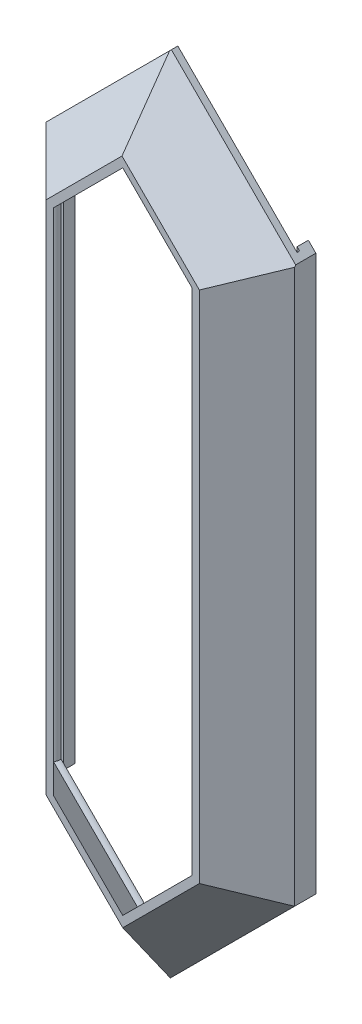
from build123d import *

# Parameters (mm, degrees)
EXTRUDE_2_DEPTH          = 8
CUT_EXTRUDE_1_DEPTH      = 8
CUT_EXTRUDE_1_DRAFT      = -45
SKETCH_3_OUTSIDE_W       = 84.568
SKETCH_3_OUTSIDE_H       = 173.168
CUT_EXTRUDE_5_DEPTH      = 8
CUT_EXTRUDE_5_DRAFT      = -45
EXTRUDE_1_DEPTH          = 3
FILLET_1_R               = 1
FILLET_2_R               = 1
CUT_EXTRUDE_6_DEPTH      = 37.9
CUT_EXTRUDE_6_DEPTH_BACK = 0.4
SKETCH_5_W               = 0.4
SKETCH_5_H               = 87.60588745
SKETCH_7_W               = 38.3
SKETCH_7_H               = 22.901916238
CUT_EXTRUDE_8_DEPTH      = 0.4
SKETCH_8_W               = 38.3
SKETCH_8_H               = 25.571304525
CUT_EXTRUDE_9_DEPTH      = 0.4
SKETCH_9_W               = 37.268690424
SKETCH_9_H               = 136.16118074
CUT_EXTRUDE_10_DEPTH     = 1.8


with BuildPart() as part:
    # Skizze1 → Бобышка-Вытянуть2 (new body)
    with BuildSketch(Plane.XY):
        Polygon((-19.834345212, 44.1), (0, 63.934345212), (19.834345212, 44.1), (19.834345212, -44.5), (0, -64.334345212), (-19.834345212, -44.5), align=None)
    extrude(amount=EXTRUDE_2_DEPTH)


with BuildPart() as cut_extrude_1_tool:
    # Эскиз1 → Вырез-Вытянуть1 (with draft: the straight prism first)
    with BuildSketch(Plane(origin=(0, 0, 0), x_dir=(-1, 0, 0), z_dir=(0, 0, -1))):
        Polygon((0, 62.802974362), (-19.034345212, 43.76862915), (-19.034345212, -44.16862915), (0, -63.202974362), (19.034345212, -44.16862915), (19.034345212, 43.76862915), align=None)
    extrude(amount=-CUT_EXTRUDE_1_DEPTH)
    # Вырез-Вытянуть1: the draft: its side faces are tilted about the plane it starts from
    cut_extrude_1_sides = [cut_extrude_1_tool.faces().sort_by_distance(p)[0] for p in [
        (9.517172606, 53.285801756, 4),
        (19.034345212, -0.2, 4),
        (9.517172606, -53.685801756, 4),
        (-9.517172606, -53.685801756, 4),
        (-19.034345212, -0.2, 4),
        (-9.517172606, 53.285801756, 4),
    ]]
    draft(cut_extrude_1_sides, Plane(origin=(0, 0, 0), x_dir=(-1, 0, 0), z_dir=(0, 0, -1)), CUT_EXTRUDE_1_DRAFT)


with BuildPart() as part_1:
    add(part.part)

    # Вырез-Вытянуть1: cut by cut_extrude_1_tool
    add(cut_extrude_1_tool.part, mode=Mode.SUBTRACT)


with BuildPart() as cut_extrude_5_tool:
    # Эскиз3 outside → Вырез-Вытянуть5 (with draft: the straight prism first)
    with BuildSketch(Plane.XY.offset(8)):
        with Locations((0, -0.2)):
            Rectangle(SKETCH_3_OUTSIDE_W, SKETCH_3_OUTSIDE_H)
        Polygon((-12.234345212, 40.951976926), (-12.234345212, -41.351976926), (0, -53.586322138), (12.234345212, -41.351976926), (12.234345212, 40.711808204), (-0.120084361, 53.066237777), align=None, mode=Mode.SUBTRACT)
    extrude(amount=-CUT_EXTRUDE_5_DEPTH)
    # Вырез-Вытянуть5: the draft: its side faces are tilted about the plane it starts from
    cut_extrude_5_sides = [cut_extrude_5_tool.faces().sort_by_distance(p)[0] for p in [
        (0, -86.784, 4),
        (42.284, -0.2, 4),
        (0, 86.384, 4),
        (-42.284, -0.2, 4),
        (-6.177214787, 47.009107352, 4),
        (6.057130426, 46.889022991, 4),
        (12.234345212, -0.320084361, 4),
        (6.117172606, -47.469149532, 4),
        (-6.117172606, -47.469149532, 4),
        (-12.234345212, -0.2, 4),
    ]]
    draft(cut_extrude_5_sides, Plane.XY.offset(8), CUT_EXTRUDE_5_DRAFT)


with BuildPart() as part_2:
    add(part_1.part)

    # Вырез-Вытянуть5: cut by cut_extrude_5_tool
    add(cut_extrude_5_tool.part, mode=Mode.SUBTRACT)

    # Эскиз4 → Вытянуть-Тонкостенный1 (add)
    with BuildSketch(Plane(origin=(0, 0, 0), x_dir=(-1, 0, 0), z_dir=(0, 0, -1))):
        Polygon((19.834345212, 44.1), (19.834345212, -44.5), (0, -64.334345212), (-19.834345212, -44.5), (-19.834345212, 44.1), (0, 63.934345212), align=None)
        Polygon((18.634345212, 43.602943725), (18.634345212, -44.002943725), (0, -62.637288937), (-18.634345212, -44.002943725), (-18.634345212, 43.602943725), (0, 62.237288937), align=None, mode=Mode.SUBTRACT)
    extrude(amount=EXTRUDE_1_DEPTH)

    # Скругление1
    # the kernel refuses this fillet: 1 mm, written as the material it takes off along each edge
    with BuildSketch(Plane(origin=(-18.634345212, 45.602943725, 0), x_dir=(-1, 0, 0), z_dir=(0, -1, 0))) as fillet_1_piece_1_section:
        with BuildLine():
            CenterArc((1, 0.8), FILLET_1_R, 180, 53.130102354)
            Line((0, 0.8), (-0.02, 0.8))
            Line((-0.02, 0.8), (-0.02, 0))
            Line((-0.02, 0), (0, -0.02))
            ThreePointArc((0, -0.02), (0.2, -0.02), (0.388, -0.016))
            Line((0.388, -0.016), (0.4, 0))
        make_face()
    fillet_1_piece_1 = extrude(amount=91.60588745, mode=Mode.PRIVATE)
    fillet_1_piece_1 = split(fillet_1_piece_1, bisect_by=Plane(origin=(-18.834345212, 45.602943725, 0.2), z_dir=(0.7071067811865462, 0, -0.7071067811865488)), keep=Keep.TOP, mode=Mode.PRIVATE)
    fillet_1_piece_1 = split(fillet_1_piece_1, bisect_by=Plane(origin=(-63.437288937, 0.8, 0), z_dir=(0.7071067811865476, 0.7071067811865476, 0)), keep=Keep.TOP, mode=Mode.PRIVATE)
    fillet_1_piece_1 = split(fillet_1_piece_1, bisect_by=Plane(origin=(-17.634345212, 44.602943725, 0), z_dir=(0.7071067811865469, -0.7071067811865481, 0)), keep=Keep.TOP, mode=Mode.PRIVATE)
    add(fillet_1_piece_1, mode=Mode.SUBTRACT)
    with BuildSketch(Plane(origin=(0, 62.237288937, 0), x_dir=(-0.7071067811865469, 0.7071067811865482, 0), z_dir=(-0.7071067811865481, -0.7071067811865469, 0))) as fillet_1_piece_2_section:
        with BuildLine():
            CenterArc((1, 0.8), FILLET_1_R, 180, 53.130102354)
            Line((0, 0.8), (-0.02, 0.8))
            Line((-0.02, 0.8), (-0.02, 0))
            Line((-0.02, 0), (0, -0.02))
            ThreePointArc((0, -0.02), (0.2, -0.02), (0.388, -0.016))
            Line((0.388, -0.016), (0.4, 0))
        make_face()
    fillet_1_piece_2 = extrude(amount=28.352943725, mode=Mode.PRIVATE)
    fillet_1_piece_2 = split(fillet_1_piece_2, bisect_by=Plane(origin=(-0.141421356, 62.378710294, 0.2), z_dir=(0.499999999999999, -0.4999999999999993, -0.7071067811865488)), keep=Keep.TOP, mode=Mode.PRIVATE)
    fillet_1_piece_2 = split(fillet_1_piece_2, bisect_by=Plane(origin=(-18.634345212, 62.237288937, 0), z_dir=(1, 0, 0)), keep=Keep.TOP, mode=Mode.PRIVATE)
    add(fillet_1_piece_2, mode=Mode.SUBTRACT)
    with BuildSketch(Plane(origin=(0, 62.237288937, 0), x_dir=(-0.7071067811865469, 0.7071067811865482, 0), z_dir=(-0.7071067811865481, -0.7071067811865469, 0))) as fillet_1_piece_3a_section:
        with BuildLine():
            CenterArc((1, 0.8), FILLET_1_R, 180, 53.130102354)
            Line((0, 0.8), (-0.02, 0.8))
            Line((-0.02, 0.8), (-0.02, 0))
            Line((-0.02, 0), (0, -0.02))
            ThreePointArc((0, -0.02), (0.2, -0.02), (0.388, -0.016))
            Line((0.388, -0.016), (0.4, 0))
        make_face()
    fillet_1_piece_3a = extrude(amount=28.352943725, mode=Mode.PRIVATE)
    fillet_1_piece_3a = split(fillet_1_piece_3a, bisect_by=Plane(origin=(-9.517172606, 62.237288937, 9.517172606), z_dir=(0.7071067811865462, 0, -0.7071067811865488)), keep=Keep.TOP, mode=Mode.PRIVATE)
    fillet_1_piece_3a = split(fillet_1_piece_3a, bisect_by=Plane(origin=(-0.141421356, 62.378710294, 0.2), z_dir=(0.499999999999999, -0.4999999999999993, -0.7071067811865488)), keep=Keep.TOP, mode=Mode.PRIVATE)
    fillet_1_piece_3a = split(fillet_1_piece_3a, bisect_by=Plane(origin=(-18.634345212, 62.237288937, 0), z_dir=(-1, 0, 0)), keep=Keep.TOP, mode=Mode.PRIVATE)
    with BuildSketch(Plane(origin=(-18.634345212, 45.602943725, 0), x_dir=(-1, 0, 0), z_dir=(0, -1, 0))) as fillet_1_piece_3b_section:
        with BuildLine():
            CenterArc((1, 0.8), FILLET_1_R, 180, 53.130102354)
            Line((0, 0.8), (-0.02, 0.8))
            Line((-0.02, 0.8), (-0.02, 0))
            Line((-0.02, 0), (0, -0.02))
            ThreePointArc((0, -0.02), (0.2, -0.02), (0.388, -0.016))
            Line((0.388, -0.016), (0.4, 0))
        make_face()
    fillet_1_piece_3b = extrude(amount=91.60588745, mode=Mode.PRIVATE)
    fillet_1_piece_3b = split(fillet_1_piece_3b, bisect_by=Plane(origin=(-18.834345212, 45.602943725, 0.2), z_dir=(0.7071067811865462, 0, -0.7071067811865488)), keep=Keep.TOP, mode=Mode.PRIVATE)
    fillet_1_piece_3b = split(fillet_1_piece_3b, bisect_by=Plane(origin=(-18.275766569, 45.244365081, -0.507106781), z_dir=(0.499999999999999, -0.4999999999999993, -0.7071067811865488)), keep=Keep.TOP, mode=Mode.PRIVATE)
    fillet_1_piece_3b = split(fillet_1_piece_3b, bisect_by=Plane(origin=(-17.634345212, 44.602943725, 0), z_dir=(-0.7071067811865469, 0.7071067811865481, 0)), keep=Keep.TOP, mode=Mode.PRIVATE)
    fillet_1_piece_3 = fillet_1_piece_3a & fillet_1_piece_3b
    add(fillet_1_piece_3, mode=Mode.SUBTRACT)

    # Скругление2
    # the kernel refuses this fillet: 1 mm, written as the material it takes off along each edge
    with BuildSketch(Plane(origin=(-20.802112165, -41.835176772, 0), x_dir=(-0.7071067811865467, -0.7071067811865485, -2.6367796834847523e-15), z_dir=(0.7071067811865485, -0.7071067811865466, 0))) as fillet_2_piece_1_section:
        with BuildLine():
            CenterArc((FILLET_2_R, FILLET_2_R), FILLET_2_R, 180, 90)
            Line((0, FILLET_2_R), (0, 0))
            Line((0, 0), (FILLET_2_R, 0))
        make_face()
    fillet_2_piece_1 = extrude(amount=2.899999894, mode=Mode.PRIVATE)
    fillet_2_piece_1 = fillet_2_piece_1 - Plane(origin=(-19.634345212, -41.835176772, -0.8), x_dir=(-1, 0, 0), z_dir=(0, 1, 0)) * Cylinder(1, 10, mode=Mode.PRIVATE)
    add(fillet_2_piece_1, mode=Mode.SUBTRACT)
    with BuildSketch(Plane(origin=(-18.751502574, -43.885786363, 0), x_dir=(-0.7071067811865466, -0.7071067811865485, -1.909421767788959e-14), z_dir=(0.7071067811865485, -0.7071067811865466, 0))) as fillet_2_piece_2_section:
        with BuildLine():
            CenterArc((1, 0.8), FILLET_2_R, 180, 53.130102354)
            Line((0, 0.8), (0, 0))
            Line((0, 0), (0.4, 0))
        make_face()
    fillet_2_piece_2 = extrude(amount=26.518629256, mode=Mode.PRIVATE)
    fillet_2_piece_2 = fillet_2_piece_2 - Plane(origin=(-19.634345212, -43.885786363, -0.8), x_dir=(-1, 0, 0), z_dir=(0, 1, 0)) * Cylinder(1, 57, mode=Mode.PRIVATE)
    add(fillet_2_piece_2, mode=Mode.SUBTRACT)
    with BuildSketch(Plane(origin=(0, -62.637288937, 0), x_dir=(0.7071067811865472, -0.7071067811865478, 0), z_dir=(0.7071067811865479, 0.7071067811865474, 0))) as fillet_2_piece_3_section:
        with BuildLine():
            CenterArc((1, 0.8), FILLET_2_R, 180, 53.130102354)
            Line((0, 0.8), (0, 0))
            Line((0, 0), (0.4, 0))
        make_face()
    fillet_2_piece_3 = extrude(amount=28.352943725, mode=Mode.PRIVATE)
    fillet_2_piece_3 = split(fillet_2_piece_3, bisect_by=Plane(origin=(18.634345212, -62.637288937, 0), z_dir=(-1, 0, 0)), keep=Keep.TOP, mode=Mode.PRIVATE)
    add(fillet_2_piece_3, mode=Mode.SUBTRACT)
    with BuildSketch(Plane(origin=(18.634345212, -46.002943725, 0), x_dir=(1, 0, 0), z_dir=(0, 1, 0))) as fillet_2_piece_4_section:
        with BuildLine():
            CenterArc((1, 0.8), FILLET_2_R, 180, 53.130102354)
            Line((0, 0.8), (0, 0))
            Line((0, 0), (0.4, 0))
        make_face()
    fillet_2_piece_4 = extrude(amount=91.60588745, mode=Mode.PRIVATE)
    fillet_2_piece_4 = split(fillet_2_piece_4, bisect_by=Plane(origin=(17.634345212, -45.002943725, 0), z_dir=(-0.7071067811865472, 0.7071067811865478, 0)), keep=Keep.TOP, mode=Mode.PRIVATE)
    fillet_2_piece_4 = split(fillet_2_piece_4, bisect_by=Plane(origin=(63.437288937, -1.2, 0), z_dir=(-0.7071067811865478, -0.7071067811865472, 0)), keep=Keep.TOP, mode=Mode.PRIVATE)
    add(fillet_2_piece_4, mode=Mode.SUBTRACT)
    with BuildSketch(Plane(origin=(20.048558775, 42.188730163, 0), x_dir=(0.7071067811865491, 0.707106781186546, 5.342948306008711e-15), z_dir=(-0.707106781186546, 0.7071067811865491, 0))) as fillet_2_piece_5_section:
        with BuildLine():
            CenterArc((1, 0.8), FILLET_2_R, 180, 53.130102354)
            Line((0, 0.8), (0, 0))
            Line((0, 0), (0.4, 0))
        make_face()
    fillet_2_piece_5 = extrude(amount=30.752943725, mode=Mode.PRIVATE)
    fillet_2_piece_5 = fillet_2_piece_5 - Plane(origin=(-0.707106781, 62.944395719, -0.8), x_dir=(-0.7071067811865476, 0.7071067811865476, 0), z_dir=(0.7071067811865476, 0.7071067811865476, 0)) * Cylinder(1, 65, mode=Mode.PRIVATE)
    fillet_2_piece_5 = split(fillet_2_piece_5, bisect_by=Plane(origin=(18.634345212, 42.188730163, 0), z_dir=(-1, 0, 0)), keep=Keep.TOP, mode=Mode.PRIVATE)
    add(fillet_2_piece_5, mode=Mode.SUBTRACT)
    with BuildSketch(Plane(origin=(-1.414213562, -64.0515025, 0), x_dir=(0.7071067811865472, -0.7071067811865478, 0), z_dir=(0.7071067811865479, 0.7071067811865474, 0))) as fillet_2_piece_6a_section:
        with BuildLine():
            CenterArc((1, 0.8), FILLET_2_R, 180, 53.130102354)
            Line((0, 0.8), (0, 0))
            Line((0, 0), (0.4, 0))
        make_face()
    fillet_2_piece_6a = extrude(amount=30.352943725, mode=Mode.PRIVATE)
    fillet_2_piece_6a = split(fillet_2_piece_6a, bisect_by=Plane(origin=(-0.848528137, -63.485817075, -0.8), z_dir=(0.4999999999999991, 0.4999999999999993, -0.7071067811865489)), keep=Keep.TOP, mode=Mode.PRIVATE)
    fillet_2_piece_6a = split(fillet_2_piece_6a, bisect_by=Plane(origin=(0, -62.637288937, 0), z_dir=(-0.7071067811865476, -0.7071067811865476, 0)), keep=Keep.TOP, mode=Mode.PRIVATE)
    with BuildSketch(Plane(origin=(-18.751502574, -43.885786363, 0), x_dir=(-0.7071067811865466, -0.7071067811865485, -1.909421767788959e-14), z_dir=(0.7071067811865485, -0.7071067811865466, 0))) as fillet_2_piece_6b_section:
        with BuildLine():
            CenterArc((1, 0.8), FILLET_2_R, 180, 53.130102354)
            Line((0, 0.8), (0, 0))
            Line((0, 0), (0.4, 0))
        make_face()
    fillet_2_piece_6b = extrude(amount=28.518629256, mode=Mode.PRIVATE)
    fillet_2_piece_6b = split(fillet_2_piece_6b, bisect_by=Plane(origin=(0, -62.637288937, 0), z_dir=(0.7071067811865472, -0.7071067811865478, 0)), keep=Keep.TOP, mode=Mode.PRIVATE)
    fillet_2_piece_6b = split(fillet_2_piece_6b, bisect_by=Plane(origin=(-9.234329931, -53.402959006, 13.459314628), z_dir=(-0.4999999999999991, 0.4999999999999991, -0.7071067811865488)), keep=Keep.TOP, mode=Mode.PRIVATE)
    fillet_2_piece_6 = fillet_2_piece_6a & fillet_2_piece_6b
    add(fillet_2_piece_6, mode=Mode.SUBTRACT)
    with BuildSketch(Plane(origin=(18.634345212, -46.002943725, 0), x_dir=(1, 0, 0), z_dir=(0, 1, 0))) as fillet_2_piece_7a_section:
        with BuildLine():
            CenterArc((1, 0.8), FILLET_2_R, 180, 53.130102354)
            Line((0, 0.8), (0, 0))
            Line((0, 0), (0.4, 0))
        make_face()
    fillet_2_piece_7a = extrude(amount=91.60588745, mode=Mode.PRIVATE)
    fillet_2_piece_7a = split(fillet_2_piece_7a, bisect_by=Plane(origin=(17.634345212, -45.002943725, 0), z_dir=(0.7071067811865472, -0.7071067811865478, 0)), keep=Keep.TOP, mode=Mode.PRIVATE)
    fillet_2_piece_7a = split(fillet_2_piece_7a, bisect_by=Plane(origin=(18.275766569, -45.644365081, -0.507106781), z_dir=(-0.4999999999999991, 0.4999999999999991, -0.7071067811865488)), keep=Keep.TOP, mode=Mode.PRIVATE)
    with BuildSketch(Plane(origin=(0, -62.637288937, 0), x_dir=(0.7071067811865472, -0.7071067811865478, 0), z_dir=(0.7071067811865479, 0.7071067811865474, 0))) as fillet_2_piece_7b_section:
        with BuildLine():
            CenterArc((1, 0.8), FILLET_2_R, 180, 53.130102354)
            Line((0, 0.8), (0, 0))
            Line((0, 0), (0.4, 0))
        make_face()
    fillet_2_piece_7b = extrude(amount=28.352943725, mode=Mode.PRIVATE)
    fillet_2_piece_7b = split(fillet_2_piece_7b, bisect_by=Plane(origin=(18.634345212, -62.637288937, 0), z_dir=(1, 0, 0)), keep=Keep.TOP, mode=Mode.PRIVATE)
    fillet_2_piece_7b = split(fillet_2_piece_7b, bisect_by=Plane(origin=(9.517172606, -62.637288937, 9.517172606), z_dir=(-0.7071067811865462, 0, -0.7071067811865488)), keep=Keep.TOP, mode=Mode.PRIVATE)
    fillet_2_piece_7 = fillet_2_piece_7a & fillet_2_piece_7b
    add(fillet_2_piece_7, mode=Mode.SUBTRACT)
    with BuildSketch(Plane(origin=(20.048558775, 42.188730163, 0), x_dir=(0.7071067811865491, 0.707106781186546, 5.342948306008711e-15), z_dir=(-0.707106781186546, 0.7071067811865491, 0))) as fillet_2_piece_8a_section:
        with BuildLine():
            CenterArc((1, 0.8), FILLET_2_R, 180, 53.130102354)
            Line((0, 0.8), (0, 0))
            Line((0, 0), (0.4, 0))
        make_face()
    fillet_2_piece_8a = extrude(amount=30.752943725, mode=Mode.PRIVATE)
    fillet_2_piece_8a = split(fillet_2_piece_8a, bisect_by=Plane(origin=(18.634345212, 42.188730163, 0), z_dir=(1, 0, 0)), keep=Keep.TOP, mode=Mode.PRIVATE)
    fillet_2_piece_8a = split(fillet_2_piece_8a, bisect_by=Plane(origin=(19.541451993, 42.188730163, -0.507106781), z_dir=(-0.7071067811865462, 0, -0.7071067811865488)), keep=Keep.TOP, mode=Mode.PRIVATE)
    with BuildSketch(Plane(origin=(18.634345212, -46.002943725, 0), x_dir=(1, 0, 0), z_dir=(0, 1, 0))) as fillet_2_piece_8b_section:
        with BuildLine():
            CenterArc((1, 0.8), FILLET_2_R, 180, 53.130102354)
            Line((0, 0.8), (0, 0))
            Line((0, 0), (0.4, 0))
        make_face()
    fillet_2_piece_8b = extrude(amount=91.60588745, mode=Mode.PRIVATE)
    fillet_2_piece_8b = split(fillet_2_piece_8b, bisect_by=Plane(origin=(63.437288937, -1.2, 0), z_dir=(0.7071067811865478, 0.7071067811865472, 0)), keep=Keep.TOP, mode=Mode.PRIVATE)
    fillet_2_piece_8b = split(fillet_2_piece_8b, bisect_by=Plane(origin=(41.177238431, -23.460050506, 31.880465325), z_dir=(-0.4999999999999991, -0.4999999999999991, -0.7071067811865488)), keep=Keep.TOP, mode=Mode.PRIVATE)
    fillet_2_piece_8 = fillet_2_piece_8a & fillet_2_piece_8b
    add(fillet_2_piece_8, mode=Mode.SUBTRACT)

    # Эскиз5 → Вырез-Вытянуть6 (cut, two sides: drawn at the far end of the back side and taken through both)
    with BuildSketch(Plane.ZY.offset(-18.634345212).offset(-CUT_EXTRUDE_6_DEPTH_BACK)):
        with Locations((-1, -0.2)):
            Rectangle(SKETCH_5_W, SKETCH_5_H)
    extrude(amount=CUT_EXTRUDE_6_DEPTH + CUT_EXTRUDE_6_DEPTH_BACK, mode=Mode.SUBTRACT)

    # Эскиз7 → Вырез-Вытянуть8 (cut)
    with BuildSketch(Plane(origin=(0, 0, -0.8), x_dir=(-1, 0, 0), z_dir=(0, 0, -1))):
        with Locations((0.115654788, 55.053901844)):
            Rectangle(SKETCH_7_W, SKETCH_7_H)
    extrude(amount=CUT_EXTRUDE_8_DEPTH, mode=Mode.SUBTRACT)

    # Эскиз8 → Вырез-Вытянуть9 (cut)
    with BuildSketch(Plane(origin=(0, 0, -0.8), x_dir=(-1, 0, 0), z_dir=(0, 0, -1))):
        with Locations((0.115654788, -56.788595988)):
            Rectangle(SKETCH_8_W, SKETCH_8_H)
    extrude(amount=CUT_EXTRUDE_9_DEPTH, mode=Mode.SUBTRACT)

    # Эскиз9 → Вырез-Вытянуть10 (cut)
    with BuildSketch(Plane(origin=(0, 0, -3), x_dir=(-1, 0, 0), z_dir=(0, 0, -1))):
        with Locations((0, 0.604946385)):
            Rectangle(SKETCH_9_W, SKETCH_9_H)
    extrude(amount=-CUT_EXTRUDE_10_DEPTH, mode=Mode.SUBTRACT)


solid = part_2.part
